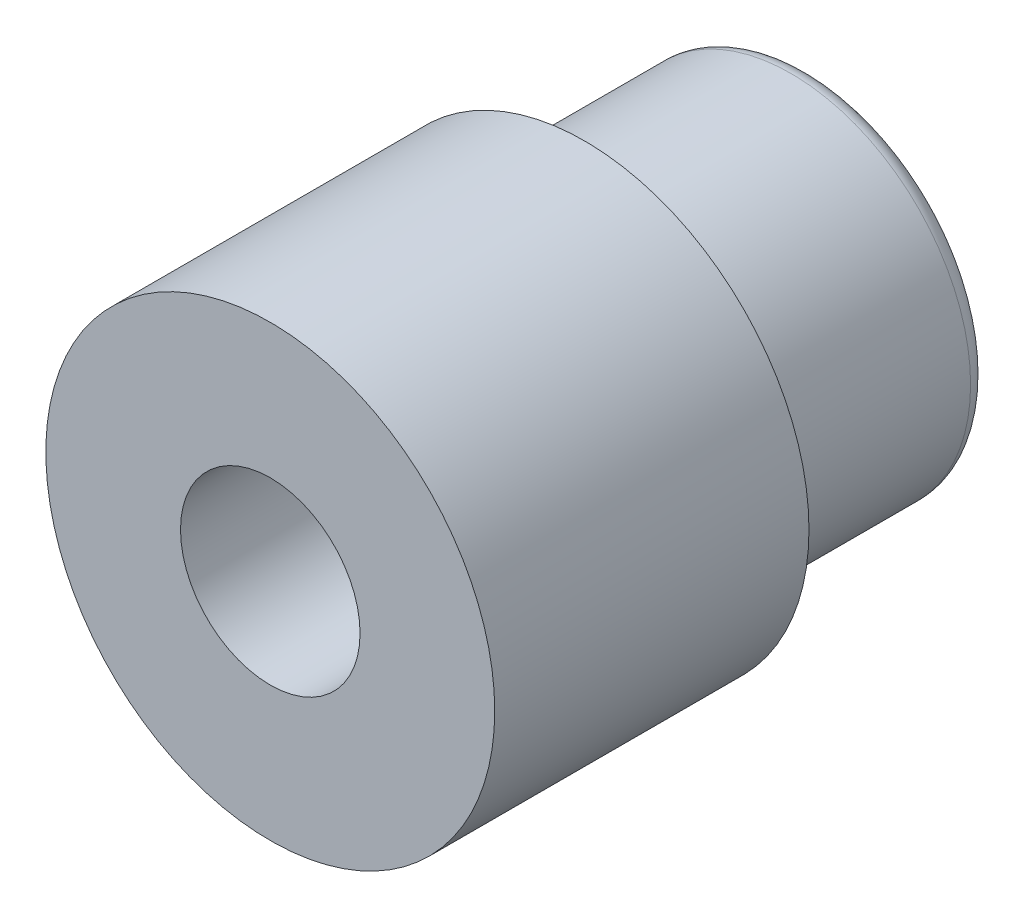
from build123d import *

# Parameters (mm, degrees)
VERRUNDUNG1_R = 0.8
VERRUNDUNG2_R = 0.2


with BuildPart() as part:
    # Skizze1 → Rotation1 (revolve)
    with BuildSketch(Plane(origin=(0, 0, 0), x_dir=(0, 0, -1), z_dir=(1, 0, 0)), mode=Mode.PRIVATE) as rotation1_sk:
        Polygon((0, 2.5), (0, 1), (6, 1), (6, 2), (3.5, 2), (3.5, 2.5), align=None)
    revolve(rotation1_sk.sketch.rotate(Axis((0, 0, 0), (0, 0, -1)), 90), axis=Axis((0, 0, 0), (0, 0, -1)))

    # Verrundung1
    verrundung1_edges = [part.edges().sort_by_distance(p)[0] for p in [
        (-1, 0, -6),
    ]]
    fillet(verrundung1_edges, radius=VERRUNDUNG1_R)

    # Verrundung2
    verrundung2_edges = [part.edges().sort_by_distance(p)[0] for p in [
        (-2, 0, -6),
    ]]
    fillet(verrundung2_edges, radius=VERRUNDUNG2_R - 0.0001)  # a hair under: the kernel refuses the full size


solid = part.part
